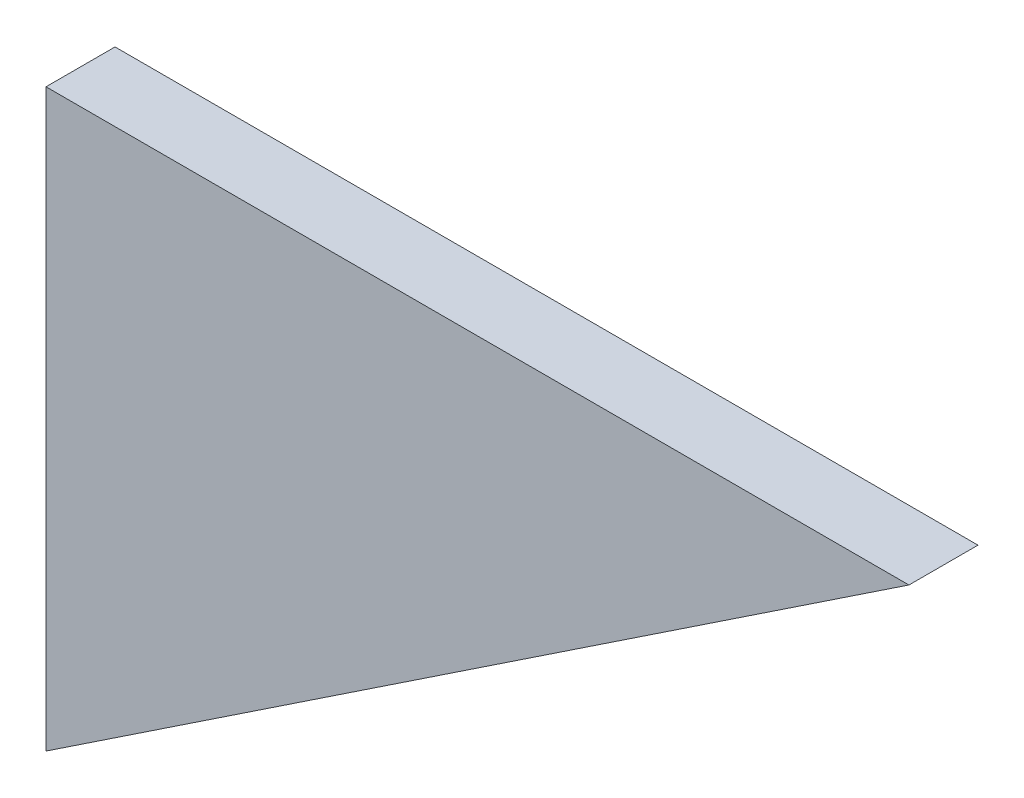
from build123d import *

# Parameters (mm, degrees)
EXTRUDE_1_DEPTH = 6


with BuildPart() as part:
    # Эскиз1 → Бобышка-Вытянуть1 (new body)
    with BuildSketch(Plane.XY):
        Polygon((6, -293.846153846), (6, -343.846153846), (81, -293.846153846), align=None)
    extrude(amount=-EXTRUDE_1_DEPTH)


solid = part.part
